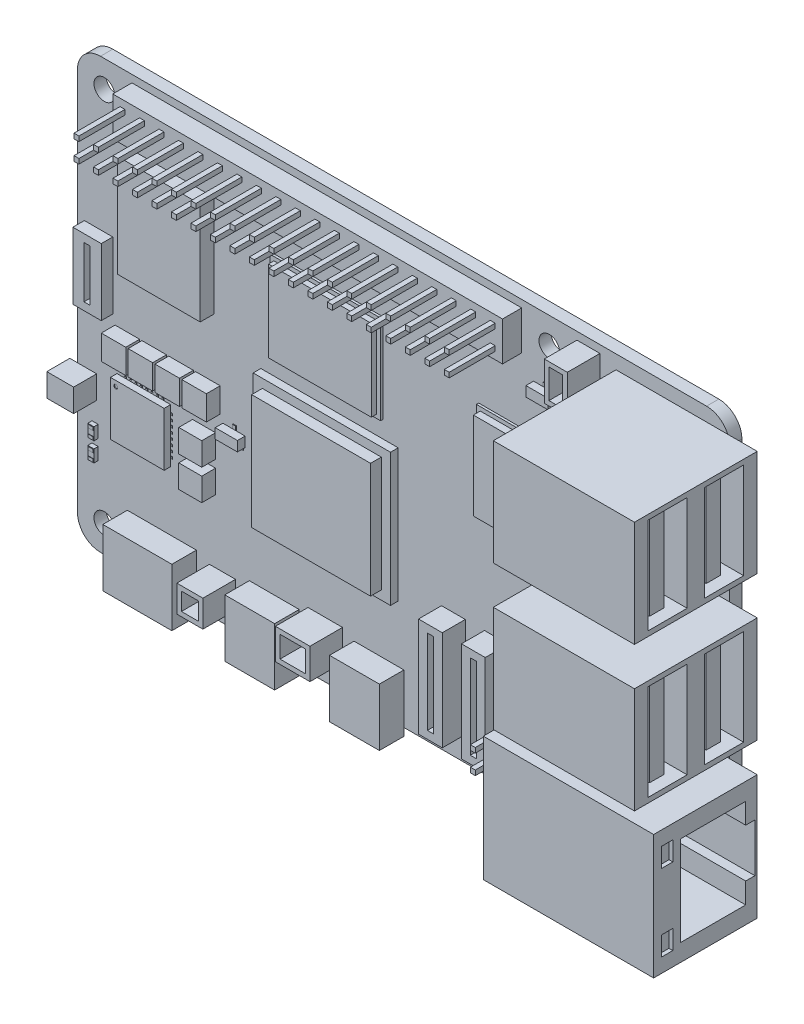
from build123d import *

# Parameters (mm, degrees)
PCB_DEPTH              = 1.6
SKETCH2_W              = 50.8
SKETCH2_H              = 5.08
SKETCH2_W_2            = 5.08
HEADER_BLOCKS_DEPTH    = 2.5
SKETCH3_W              = 0.64
SKETCH3_H              = 0.64
HEADER_PINS_DEPTH      = 6
SKETCH4_W              = 0.25
SKETCH4_H              = 0.3
SKETCH4_W_2            = 0.3
SKETCH4_H_2            = 0.25
PARTS_ADD00_DEPTH      = 0.05
SKETCH5_W              = 0.4
SKETCH5_H              = 0.7
PARTS_ADD01_DEPTH      = 0.1
SKETCH6_W              = 14.4
SKETCH6_H              = 11.6
SKETCH6_W_2            = 12.9
SKETCH6_H_2            = 12.4
PARTS_ADD02_DEPTH      = 0.3
SKETCH7_W              = 0.8
SKETCH7_H              = 1.6
PARTS_ADD03_DEPTH      = 0.55
PARTS_ADD04_DEPTH      = 0.9
SKETCH9_W              = 17.9
SKETCH9_H              = 17.3
PARTS_ADD05_DEPTH      = 1
SKETCH10_W             = 3.7
SKETCH10_H             = 8.7
PARTS_ADD06_DEPTH      = 1.5
SKETCH11_W             = 10.8
SKETCH11_H             = 13.3
SKETCH11_W_2           = 3.2
SKETCH11_H_2           = 3.2
SKETCH11_W_3           = 3
SKETCH11_H_3           = 3
PARTS_ADD07_DEPTH      = 1.8
SKETCH12_W             = 3.1
SKETCH12_H             = 13
SKETCH12_W_2           = 3.5
SKETCH12_H_2           = 3
PARTS_ADD08_DEPTH      = 3
SKETCH13_W             = 6.5
SKETCH13_H             = 7.5
SKETCH13_W_2           = 9
PARTS_ADD09_DEPTH      = 3.2
SKETCH14_W             = 3
SKETCH14_H             = 5
SKETCH14_W_2           = 4.5
SKETCH14_H_2           = 4
SKETCH14_W_3           = 3.4
SKETCH14_H_3           = 3.5
PARTS_ADD10_DEPTH      = 4.25
SKETCH15_W             = 22.2
SKETCH15_H             = 16.2
PARTS_ADD11_DEPTH      = 13.5
SKETCH16_W             = 18.4
SKETCH16_H             = 13.8
PARTS_ADD12_DEPTH      = 16
SKETCH17_W             = 7
SKETCH17_H             = 7
PARTS_ADD13_DEPTH      = 0.85
SKETCH18_W             = 4
SKETCH18_H             = 4.5
PARTS_ADD14_DEPTH      = 0.95
SKETCH19_W             = 2.9
SKETCH19_H             = 1.3
PARTS_ADD15_DEPTH      = 1
SKETCH20_W             = 13.4
SKETCH20_H             = 10.6
PARTS_ADD16_DEPTH      = 0.7
SKETCH21_W             = 11.9
SKETCH21_H             = 11.4
PARTS_ADD17_DEPTH      = 0.9
SKETCH22_W             = 0.7
SKETCH22_H             = 0.4
PARTS_ADD18_DEPTH      = 0.05
SKETCH23_W             = 15.5
SKETCH23_H             = 15
PARTS_ADD19_DEPTH      = 1.4
SKETCH24_W             = 1.5
SKETCH24_H             = 2.5
PARTS_CUT00_DEPTH      = 0.5
SKETCH25_W             = 1.9
SKETCH25_H             = 11
PARTS_CUT01_DEPTH      = 0.8
SKETCH26_W             = 5.1
SKETCH26_H             = 12.5
SKETCH26_W_2           = 1.9
SKETCH26_H_2           = 11
PARTS_CUT02_DEPTH      = 14
PARTS_CUT03_DEPTH      = 18
SKETCH28_W             = 4.2
SKETCH28_H             = 0.6
SKETCH28_W_2           = 6.6
SKETCH28_H_2           = 0.7
PARTS_CUT04_DEPTH      = 0.5
SKETCH29_W             = 5.5
SKETCH29_H             = 2
SKETCH29_W_2           = 4.2
SKETCH29_H_2           = 0.6
SKETCH29_W_3           = 6.6
SKETCH29_H_3           = 0.7
PARTS_CUT05_DEPTH      = 7
SKETCH30_R             = 0.25
PARTS_CUT06_DEPTH      = 0.1
SKETCH31_R             = 0.25
PARTS_CUT07_DEPTH      = 0.1
SKETCH32_W             = 0.8
SKETCH32_H             = 6.7
PARTS_CUT08_DEPTH      = 1
SKETCH33_W             = 0.8
SKETCH33_H             = 11
PARTS_CUT09_DEPTH      = 2.5
SKETCH34_W             = 1.8
SKETCH34_H             = 3.8
SKETCH34_W_2           = 3.3
SKETCH34_H_2           = 2.8
SKETCH34_W_3           = 2.2
SKETCH34_H_3           = 2.3
PARTS_CUT10_DEPTH      = 3.25
MOUNT_HOLES_DEPTH      = 107.281324794
MOUNT_HOLES_DEPTH_BACK = 107.281324794
SKETCH35_R             = 1.35


with BuildPart() as part:
    # Sketch1 → PCB (new body)
    with BuildSketch(Plane.XY):
        with BuildLine():
            Line((3, 0), (82, 0))
            ThreePointArc((82, 0), (84.121320344, 0.878679656), (85, 3))
            Line((85, 3), (85, 53))
            ThreePointArc((85, 53), (84.121320344, 55.121320344), (82, 56))
            Line((82, 56), (3, 56))
            ThreePointArc((3, 56), (0.878679656, 55.121320344), (0, 53))
            Line((0, 53), (0, 3))
            ThreePointArc((0, 3), (0.878679656, 0.878679656), (3, 0))
        make_face()
    extrude(amount=PCB_DEPTH)

    # Sketch2 → Header_Blocks (add)
    with BuildSketch(Plane.XY.offset(1.6)):
        with Locations((32.5, 52.5)):
            Rectangle(SKETCH2_W, SKETCH2_H)
        with Locations((61.3, 9.3)):
            Rectangle(SKETCH2_W_2, SKETCH2_H)
    extrude(amount=HEADER_BLOCKS_DEPTH)

    # Sketch3 → Header_Pins (add)
    with BuildSketch(Plane.XY.offset(4.1)):
        with Locations((8.37, 51.23)):
            Rectangle(SKETCH3_W, SKETCH3_H)
        with Locations((8.37, 53.77)):
            Rectangle(SKETCH3_W, SKETCH3_H)
        with Locations((10.91, 51.23)):
            Rectangle(SKETCH3_W, SKETCH3_H)
        with Locations((10.91, 53.77)):
            Rectangle(SKETCH3_W, SKETCH3_H)
        with Locations((13.45, 51.23)):
            Rectangle(SKETCH3_W, SKETCH3_H)
        with Locations((13.45, 53.77)):
            Rectangle(SKETCH3_W, SKETCH3_H)
        with Locations((15.99, 51.23)):
            Rectangle(SKETCH3_W, SKETCH3_H)
        with Locations((15.99, 53.77)):
            Rectangle(SKETCH3_W, SKETCH3_H)
        with Locations((18.53, 51.23)):
            Rectangle(SKETCH3_W, SKETCH3_H)
        with Locations((18.53, 53.77)):
            Rectangle(SKETCH3_W, SKETCH3_H)
        with Locations((21.07, 51.23)):
            Rectangle(SKETCH3_W, SKETCH3_H)
        with Locations((21.07, 53.77)):
            Rectangle(SKETCH3_W, SKETCH3_H)
        with Locations((23.61, 51.23)):
            Rectangle(SKETCH3_W, SKETCH3_H)
        with Locations((23.61, 53.77)):
            Rectangle(SKETCH3_W, SKETCH3_H)
        with Locations((26.15, 51.23)):
            Rectangle(SKETCH3_W, SKETCH3_H)
        with Locations((26.15, 53.77)):
            Rectangle(SKETCH3_W, SKETCH3_H)
        with Locations((28.69, 51.23)):
            Rectangle(SKETCH3_W, SKETCH3_H)
        with Locations((28.69, 53.77)):
            Rectangle(SKETCH3_W, SKETCH3_H)
        with Locations((31.23, 51.23)):
            Rectangle(SKETCH3_W, SKETCH3_H)
        with Locations((31.23, 53.77)):
            Rectangle(SKETCH3_W, SKETCH3_H)
        with Locations((33.77, 51.23)):
            Rectangle(SKETCH3_W, SKETCH3_H)
        with Locations((33.77, 53.77)):
            Rectangle(SKETCH3_W, SKETCH3_H)
        with Locations((36.31, 51.23)):
            Rectangle(SKETCH3_W, SKETCH3_H)
        with Locations((36.31, 53.77)):
            Rectangle(SKETCH3_W, SKETCH3_H)
        with Locations((38.85, 51.23)):
            Rectangle(SKETCH3_W, SKETCH3_H)
        with Locations((38.85, 53.77)):
            Rectangle(SKETCH3_W, SKETCH3_H)
        with Locations((41.39, 51.23)):
            Rectangle(SKETCH3_W, SKETCH3_H)
        with Locations((41.39, 53.77)):
            Rectangle(SKETCH3_W, SKETCH3_H)
        with Locations((43.93, 51.23)):
            Rectangle(SKETCH3_W, SKETCH3_H)
        with Locations((43.93, 53.77)):
            Rectangle(SKETCH3_W, SKETCH3_H)
        with Locations((46.47, 51.23)):
            Rectangle(SKETCH3_W, SKETCH3_H)
        with Locations((46.47, 53.77)):
            Rectangle(SKETCH3_W, SKETCH3_H)
        with Locations((49.01, 51.23)):
            Rectangle(SKETCH3_W, SKETCH3_H)
        with Locations((49.01, 53.77)):
            Rectangle(SKETCH3_W, SKETCH3_H)
        with Locations((51.55, 51.23)):
            Rectangle(SKETCH3_W, SKETCH3_H)
        with Locations((51.55, 53.77)):
            Rectangle(SKETCH3_W, SKETCH3_H)
        with Locations((54.09, 51.23)):
            Rectangle(SKETCH3_W, SKETCH3_H)
        with Locations((54.09, 53.77)):
            Rectangle(SKETCH3_W, SKETCH3_H)
        with Locations((56.63, 51.23)):
            Rectangle(SKETCH3_W, SKETCH3_H)
        with Locations((56.63, 53.77)):
            Rectangle(SKETCH3_W, SKETCH3_H)
        with Locations((60.03, 8.03)):
            Rectangle(SKETCH3_W, SKETCH3_H)
        with Locations((60.03, 10.57)):
            Rectangle(SKETCH3_W, SKETCH3_H)
        with Locations((62.57, 8.03)):
            Rectangle(SKETCH3_W, SKETCH3_H)
        with Locations((62.57, 10.57)):
            Rectangle(SKETCH3_W, SKETCH3_H)
    extrude(amount=HEADER_PINS_DEPTH)

    # Sketch4 → Parts_add00 (add)
    with BuildSketch(Plane.XY.offset(1.6)):
        with Locations((6.25, 14.25)):
            Rectangle(SKETCH4_W, SKETCH4_H)
        with Locations((5.15, 15.35)):
            Rectangle(SKETCH4_W_2, SKETCH4_H_2)
        with Locations((6.25, 21.35)):
            Rectangle(SKETCH4_W, SKETCH4_H)
        with Locations((12.25, 15.35)):
            Rectangle(SKETCH4_W_2, SKETCH4_H_2)
        with Locations((6.95, 14.25)):
            Rectangle(SKETCH4_W, SKETCH4_H)
        with Locations((5.15, 16.05)):
            Rectangle(SKETCH4_W_2, SKETCH4_H_2)
        with Locations((6.95, 21.35)):
            Rectangle(SKETCH4_W, SKETCH4_H)
        with Locations((12.25, 16.05)):
            Rectangle(SKETCH4_W_2, SKETCH4_H_2)
        with Locations((7.65, 14.25)):
            Rectangle(SKETCH4_W, SKETCH4_H)
        with Locations((5.15, 16.75)):
            Rectangle(SKETCH4_W_2, SKETCH4_H_2)
        with Locations((7.65, 21.35)):
            Rectangle(SKETCH4_W, SKETCH4_H)
        with Locations((12.25, 16.75)):
            Rectangle(SKETCH4_W_2, SKETCH4_H_2)
        with Locations((8.35, 14.25)):
            Rectangle(SKETCH4_W, SKETCH4_H)
        with Locations((5.15, 17.45)):
            Rectangle(SKETCH4_W_2, SKETCH4_H_2)
        with Locations((8.35, 21.35)):
            Rectangle(SKETCH4_W, SKETCH4_H)
        with Locations((12.25, 17.45)):
            Rectangle(SKETCH4_W_2, SKETCH4_H_2)
        with Locations((9.05, 14.25)):
            Rectangle(SKETCH4_W, SKETCH4_H)
        with Locations((5.15, 18.15)):
            Rectangle(SKETCH4_W_2, SKETCH4_H_2)
        with Locations((9.05, 21.35)):
            Rectangle(SKETCH4_W, SKETCH4_H)
        with Locations((12.25, 18.15)):
            Rectangle(SKETCH4_W_2, SKETCH4_H_2)
        with Locations((9.75, 14.25)):
            Rectangle(SKETCH4_W, SKETCH4_H)
        with Locations((5.15, 18.85)):
            Rectangle(SKETCH4_W_2, SKETCH4_H_2)
        with Locations((9.75, 21.35)):
            Rectangle(SKETCH4_W, SKETCH4_H)
        with Locations((12.25, 18.85)):
            Rectangle(SKETCH4_W_2, SKETCH4_H_2)
        with Locations((10.45, 14.225)):
            Rectangle(SKETCH4_W, SKETCH4_H_2)
        with Locations((5.125, 19.55)):
            Rectangle(SKETCH4_W, SKETCH4_H_2)
        with Locations((10.45, 21.35)):
            Rectangle(SKETCH4_W, SKETCH4_H)
        with Locations((12.25, 19.55)):
            Rectangle(SKETCH4_W_2, SKETCH4_H_2)
        with Locations((11.15, 14.25)):
            Rectangle(SKETCH4_W, SKETCH4_H)
        with Locations((5.15, 20.25)):
            Rectangle(SKETCH4_W_2, SKETCH4_H_2)
        with Locations((11.15, 21.35)):
            Rectangle(SKETCH4_W, SKETCH4_H)
        with Locations((12.25, 20.25)):
            Rectangle(SKETCH4_W_2, SKETCH4_H_2)
        with Locations((66.4, 43.3)):
            Rectangle(SKETCH4_W, SKETCH4_H)
        with Locations((65.35, 44.6)):
            Rectangle(SKETCH4_W_2, SKETCH4_H_2)
        with Locations((66.4, 47.9)):
            Rectangle(SKETCH4_W, SKETCH4_H)
        with Locations((69.45, 44.6)):
            Rectangle(SKETCH4_W_2, SKETCH4_H_2)
        with Locations((67.066666667, 43.3)):
            Rectangle(SKETCH4_W, SKETCH4_H)
        with Locations((65.35, 45.266666667)):
            Rectangle(SKETCH4_W_2, SKETCH4_H_2)
        with Locations((67.066666667, 47.9)):
            Rectangle(SKETCH4_W, SKETCH4_H)
        with Locations((69.45, 45.266666667)):
            Rectangle(SKETCH4_W_2, SKETCH4_H_2)
        with Locations((67.733333333, 43.3)):
            Rectangle(SKETCH4_W, SKETCH4_H)
        with Locations((65.35, 45.933333333)):
            Rectangle(SKETCH4_W_2, SKETCH4_H_2)
        with Locations((67.733333333, 47.9)):
            Rectangle(SKETCH4_W, SKETCH4_H)
        with Locations((69.45, 45.933333333)):
            Rectangle(SKETCH4_W_2, SKETCH4_H_2)
        with Locations((68.4, 43.3)):
            Rectangle(SKETCH4_W, SKETCH4_H)
        with Locations((65.35, 46.6)):
            Rectangle(SKETCH4_W_2, SKETCH4_H_2)
        with Locations((68.4, 47.9)):
            Rectangle(SKETCH4_W, SKETCH4_H)
        with Locations((69.45, 46.6)):
            Rectangle(SKETCH4_W_2, SKETCH4_H_2)
    extrude(amount=PARTS_ADD00_DEPTH)

    # Sketch5 → Parts_add01 (add)
    with BuildSketch(Plane.XY.offset(1.6)):
        with Locations((19.55, 21.2)):
            Rectangle(SKETCH5_W, SKETCH5_H)
        with Locations((21.45, 21.2)):
            Rectangle(SKETCH5_W, SKETCH5_H)
        with Locations((20.5, 22.8)):
            Rectangle(SKETCH5_W, SKETCH5_H)
        with Locations((58.55, 17.2)):
            Rectangle(SKETCH5_W, SKETCH5_H)
        with Locations((60.45, 17.2)):
            Rectangle(SKETCH5_W, SKETCH5_H)
        with Locations((59.5, 18.8)):
            Rectangle(SKETCH5_W, SKETCH5_H)
        with Locations((60.05, 46.2)):
            Rectangle(SKETCH5_W, SKETCH5_H)
        with Locations((61.95, 46.2)):
            Rectangle(SKETCH5_W, SKETCH5_H)
        with Locations((61, 47.8)):
            Rectangle(SKETCH5_W, SKETCH5_H)
    extrude(amount=PARTS_ADD01_DEPTH)

    # Sketch6 → Parts_add02 (add)
    with BuildSketch(Plane.XY.offset(1.6)):
        with Locations((32.6, 39.2)):
            Rectangle(SKETCH6_W, SKETCH6_H)
        with Locations((58.75, 35.3)):
            Rectangle(SKETCH6_W_2, SKETCH6_H_2)
    extrude(amount=PARTS_ADD02_DEPTH)

    # Sketch7 → Parts_add03 (add)
    with BuildSketch(Plane.XY.offset(1.6)):
        with Locations((2.3, 11)):
            Rectangle(SKETCH7_W, SKETCH7_H)
        with Locations((2.3, 13.5)):
            Rectangle(SKETCH7_W, SKETCH7_H)
    extrude(amount=PARTS_ADD03_DEPTH)

    # Sketch8 → Parts_add04 (add)
    with BuildSketch(Plane.XY.offset(1.6)):
        Polygon((62.7, 19.918019485), (65.881980515, 23.1), (62.7, 26.281980515), (59.518019485, 23.1), align=None)
    extrude(amount=PARTS_ADD04_DEPTH)

    # Sketch9 → Parts_add05 (add)
    with BuildSketch(Plane.XY.offset(1.6)):
        with Locations((32.85, 22.55)):
            Rectangle(SKETCH9_W, SKETCH9_H)
    extrude(amount=PARTS_ADD05_DEPTH)

    # Sketch10 → Parts_add06 (add)
    with BuildSketch(Plane.XY.offset(1.6)):
        with Locations((2.75, 32.05)):
            Rectangle(SKETCH10_W, SKETCH10_H)
    extrude(amount=PARTS_ADD06_DEPTH)

    # Sketch11 → Parts_add07 (add)
    with BuildSketch(Plane.XY.offset(1.6)):
        with Locations((12.4, 40.95)):
            Rectangle(SKETCH11_W, SKETCH11_H)
        with Locations((6.5, 25)):
            Rectangle(SKETCH11_W_2, SKETCH11_H_2)
        with Locations((10, 25)):
            Rectangle(SKETCH11_W_2, SKETCH11_H_2)
        with Locations((13.5, 25)):
            Rectangle(SKETCH11_W_2, SKETCH11_H_2)
        with Locations((17, 25)):
            Rectangle(SKETCH11_W_2, SKETCH11_H_2)
        with Locations((16.5, 19.5)):
            Rectangle(SKETCH11_W_3, SKETCH11_H_3)
        with Locations((16.5, 15.5)):
            Rectangle(SKETCH11_W_3, SKETCH11_H_3)
    extrude(amount=PARTS_ADD07_DEPTH)

    # Sketch12 → Parts_add08 (add)
    with BuildSketch(Plane.XY.offset(1.6)):
        with Locations((54.6, 9.7)):
            Rectangle(SKETCH12_W, SKETCH12_H)
        with Locations((49, 9.7)):
            Rectangle(SKETCH12_W, SKETCH12_H)
        with Locations((0.75, 18.4)):
            Rectangle(SKETCH12_W_2, SKETCH12_H_2)
    extrude(amount=PARTS_ADD08_DEPTH)

    # Sketch13 → Parts_add09 (add)
    with BuildSketch(Plane.XY.offset(1.6)):
        with Locations((25.65, 2.75)):
            Rectangle(SKETCH13_W, SKETCH13_H)
        with Locations((39.3, 2.75)):
            Rectangle(SKETCH13_W, SKETCH13_H)
        with Locations((11, 2.75)):
            Rectangle(SKETCH13_W_2, SKETCH13_H)
    extrude(amount=PARTS_ADD09_DEPTH)

    # Sketch14 → Parts_add10 (add)
    with BuildSketch(Plane.XY.offset(1.6)):
        with Locations((66.6, 52.5)):
            Rectangle(SKETCH14_W, SKETCH14_H)
        with Locations((32.3, 5.3)):
            Rectangle(SKETCH14_W_2, SKETCH14_H_2)
        with Locations((18.9, 4)):
            Rectangle(SKETCH14_W_3, SKETCH14_H_3)
    extrude(amount=PARTS_ADD10_DEPTH)

    # Sketch15 → Parts_add11 (add)
    with BuildSketch(Plane.XY.offset(1.6)):
        with Locations((77.5, 9.6)):
            Rectangle(SKETCH15_W, SKETCH15_H)
    extrude(amount=PARTS_ADD11_DEPTH)

    # Sketch16 → Parts_add12 (add)
    with BuildSketch(Plane.XY.offset(1.6)):
        with Locations((79.4, 47.3)):
            Rectangle(SKETCH16_W, SKETCH16_H)
        with Locations((79.4, 28.5)):
            Rectangle(SKETCH16_W, SKETCH16_H)
    extrude(amount=PARTS_ADD12_DEPTH)

    # Sketch17 → Parts_add13 (add)
    with BuildSketch(Plane.XY.offset(1.65)):
        with Locations((8.7, 17.8)):
            Rectangle(SKETCH17_W, SKETCH17_H)
    extrude(amount=PARTS_ADD13_DEPTH)

    # Sketch18 → Parts_add14 (add)
    with BuildSketch(Plane.XY.offset(1.65)):
        with Locations((67.4, 45.6)):
            Rectangle(SKETCH18_W, SKETCH18_H)
    extrude(amount=PARTS_ADD14_DEPTH)

    # Sketch19 → Parts_add15 (add)
    with BuildSketch(Plane.XY.offset(1.7)):
        with Locations((20.5, 22)):
            Rectangle(SKETCH19_W, SKETCH19_H)
        with Locations((59.5, 18)):
            Rectangle(SKETCH19_W, SKETCH19_H)
        with Locations((61, 47)):
            Rectangle(SKETCH19_W, SKETCH19_H)
    extrude(amount=PARTS_ADD15_DEPTH)

    # Sketch20 → Parts_add16 (add)
    with BuildSketch(Plane.XY.offset(1.9)):
        with Locations((32.6, 39.2)):
            Rectangle(SKETCH20_W, SKETCH20_H)
    extrude(amount=PARTS_ADD16_DEPTH)

    # Sketch21 → Parts_add17 (add)
    with BuildSketch(Plane.XY.offset(1.9)):
        with Locations((58.75, 35.3)):
            Rectangle(SKETCH21_W, SKETCH21_H)
    extrude(amount=PARTS_ADD17_DEPTH)

    # Sketch22 → Parts_add18 (add)
    with BuildSketch(Plane.XY.offset(2.15)):
        with Locations((2.3, 10.45)):
            Rectangle(SKETCH22_W, SKETCH22_H)
        with Locations((2.3, 11.55)):
            Rectangle(SKETCH22_W, SKETCH22_H)
        with Locations((2.3, 12.95)):
            Rectangle(SKETCH22_W, SKETCH22_H)
        with Locations((2.3, 14.05)):
            Rectangle(SKETCH22_W, SKETCH22_H)
    extrude(amount=PARTS_ADD18_DEPTH)

    # Sketch23 → Parts_add19 (add)
    with BuildSketch(Plane.XY.offset(2.6)):
        with Locations((32.85, 22.55)):
            Rectangle(SKETCH23_W, SKETCH23_H)
    extrude(amount=PARTS_ADD19_DEPTH)

    # Sketch24 → Parts_cut00 (cut)
    with BuildSketch(Plane(origin=(88.6, 0, 0), x_dir=(0, 0, -1), z_dir=(1, 0, 0))):
        with Locations((-13.35, 4.6)):
            Rectangle(SKETCH24_W, SKETCH24_H)
        with Locations((-13.35, 14.6)):
            Rectangle(SKETCH24_W, SKETCH24_H)
    extrude(amount=-PARTS_CUT00_DEPTH, mode=Mode.SUBTRACT)

    # Sketch25 → Parts_cut01 (cut)
    with BuildSketch(Plane(origin=(88.6, 0, 0), x_dir=(0, 0, -1), z_dir=(1, 0, 0))):
        with Locations((-6.52, 47.3)):
            Rectangle(SKETCH25_W, SKETCH25_H)
        with Locations((-13.88, 47.3)):
            Rectangle(SKETCH25_W, SKETCH25_H)
        with Locations((-6.52, 28.5)):
            Rectangle(SKETCH25_W, SKETCH25_H)
        with Locations((-13.88, 28.5)):
            Rectangle(SKETCH25_W, SKETCH25_H)
    extrude(amount=-PARTS_CUT01_DEPTH, mode=Mode.SUBTRACT)

    # Sketch26 → Parts_cut02 (cut)
    # profile 1 of 4: a face of its own
    with BuildSketch(Plane(origin=(88.6, 0, 0), x_dir=(0, 0, -1), z_dir=(1, 0, 0))):
        with Locations((-5.92, 47.3)):
            Rectangle(SKETCH26_W, SKETCH26_H)
        with Locations((-6.52, 47.3)):
            Rectangle(SKETCH26_W_2, SKETCH26_H_2, mode=Mode.SUBTRACT)
    # profile 2 of 4: a face of its own
    with BuildSketch(Plane(origin=(88.6, 0, 0), x_dir=(0, 0, -1), z_dir=(1, 0, 0))):
        with Locations((-13.28, 47.3)):
            Rectangle(SKETCH26_W, SKETCH26_H)
        with Locations((-13.88, 47.3)):
            Rectangle(SKETCH26_W_2, SKETCH26_H_2, mode=Mode.SUBTRACT)
    # profile 3 of 4: a face of its own
    with BuildSketch(Plane(origin=(88.6, 0, 0), x_dir=(0, 0, -1), z_dir=(1, 0, 0))):
        with Locations((-5.92, 28.5)):
            Rectangle(SKETCH26_W, SKETCH26_H)
        with Locations((-6.52, 28.5)):
            Rectangle(SKETCH26_W_2, SKETCH26_H_2, mode=Mode.SUBTRACT)
    # profile 4 of 4: a face of its own
    with BuildSketch(Plane(origin=(88.6, 0, 0), x_dir=(0, 0, -1), z_dir=(1, 0, 0))):
        with Locations((-13.28, 28.5)):
            Rectangle(SKETCH26_W, SKETCH26_H)
        with Locations((-13.88, 28.5)):
            Rectangle(SKETCH26_W_2, SKETCH26_H_2, mode=Mode.SUBTRACT)
    extrude(amount=-PARTS_CUT02_DEPTH, mode=Mode.SUBTRACT)

    # Sketch27 → Parts_cut03 (cut)
    with BuildSketch(Plane(origin=(88.6, 0, 0), x_dir=(0, 0, -1), z_dir=(1, 0, 0))):
        Polygon((-3.1, 3.75), (-3.1, 6.45), (-1.9, 6.45), (-1.9, 12.75), (-3.1, 12.75), (-3.1, 15.45), (-11.6, 15.45), (-11.6, 3.75), align=None)
    extrude(amount=-PARTS_CUT03_DEPTH, mode=Mode.SUBTRACT)

    # Sketch28 → Parts_cut04 (cut)
    with BuildSketch(Plane(origin=(0, -1, 0), x_dir=(1, 0, 0), z_dir=(0, 1, 0))):
        with Locations((25.65, -3.2)):
            Rectangle(SKETCH28_W, SKETCH28_H)
        with Locations((39.3, -3.2)):
            Rectangle(SKETCH28_W, SKETCH28_H)
        with Locations((11, -3.2)):
            Rectangle(SKETCH28_W_2, SKETCH28_H_2)
    extrude(amount=PARTS_CUT04_DEPTH, mode=Mode.SUBTRACT)

    # Sketch29 → Parts_cut05 (cut)
    # profile 1 of 3: a face of its own
    with BuildSketch(Plane(origin=(0, 6, 0), x_dir=(1, 0, 0), z_dir=(0, 1, 0))):
        with Locations((25.65, -3.2)):
            Rectangle(SKETCH29_W, SKETCH29_H)
        with Locations((25.65, -3.2)):
            Rectangle(SKETCH29_W_2, SKETCH29_H_2, mode=Mode.SUBTRACT)
    # profile 2 of 3: a face of its own
    with BuildSketch(Plane(origin=(0, 6, 0), x_dir=(1, 0, 0), z_dir=(0, 1, 0))):
        with BuildLine():
            Line((8.1, -2.25), (13.9, -2.25))
            ThreePointArc((13.9, -2.25), (15.15, -3.5), (13.9, -4.75))
            Line((13.9, -4.75), (8.1, -4.75))
            ThreePointArc((8.1, -4.75), (6.85, -3.5), (8.1, -2.25))
        make_face()
        with Locations((11, -3.2)):
            Rectangle(SKETCH29_W_3, SKETCH29_H_3, mode=Mode.SUBTRACT)
    # profile 3 of 3: a face of its own
    with BuildSketch(Plane(origin=(0, 6, 0), x_dir=(1, 0, 0), z_dir=(0, 1, 0))):
        with Locations((39.3, -3.2)):
            Rectangle(SKETCH29_W, SKETCH29_H)
        with Locations((39.3, -3.2)):
            Rectangle(SKETCH29_W_2, SKETCH29_H_2, mode=Mode.SUBTRACT)
    extrude(amount=-PARTS_CUT05_DEPTH, mode=Mode.SUBTRACT)

    # Sketch30 → Parts_cut06 (cut)
    with BuildSketch(Plane.XY.offset(2.5)):
        with Locations((5.9, 20.6)):
            Circle(SKETCH30_R)
    extrude(amount=-PARTS_CUT06_DEPTH, mode=Mode.SUBTRACT)

    # Sketch31 → Parts_cut07 (cut)
    with BuildSketch(Plane.XY.offset(2.6)):
        with Locations((66.1, 47.15)):
            Circle(SKETCH31_R)
    extrude(amount=-PARTS_CUT07_DEPTH, mode=Mode.SUBTRACT)

    # Sketch32 → Parts_cut08 (cut)
    with BuildSketch(Plane.XY.offset(3.1)):
        with Locations((2.75, 32.05)):
            Rectangle(SKETCH32_W, SKETCH32_H)
    extrude(amount=-PARTS_CUT08_DEPTH, mode=Mode.SUBTRACT)

    # Sketch33 → Parts_cut09 (cut)
    with BuildSketch(Plane.XY.offset(4.6)):
        with Locations((54.6, 9.7)):
            Rectangle(SKETCH33_W, SKETCH33_H)
        with Locations((49, 9.7)):
            Rectangle(SKETCH33_W, SKETCH33_H)
    extrude(amount=-PARTS_CUT09_DEPTH, mode=Mode.SUBTRACT)

    # Sketch34 → Parts_cut10 (cut)
    with BuildSketch(Plane.XY.offset(5.85)):
        with Locations((66.6, 52.5)):
            Rectangle(SKETCH34_W, SKETCH34_H)
        with Locations((32.3, 5.3)):
            Rectangle(SKETCH34_W_2, SKETCH34_H_2)
        with Locations((18.9, 4)):
            Rectangle(SKETCH34_W_3, SKETCH34_H_3)
    extrude(amount=-PARTS_CUT10_DEPTH, mode=Mode.SUBTRACT)

    # Sketch35 → Mount_Holes (cut, two sides: drawn at the far end of the back side and taken through both)
    with BuildSketch(Plane.XY.offset(-MOUNT_HOLES_DEPTH_BACK)):
        with Locations((3.5, 3.5)):
            Circle(SKETCH35_R)
        with Locations((3.5, 52.5)):
            Circle(SKETCH35_R)
        with Locations((61.5, 3.5)):
            Circle(SKETCH35_R)
        with Locations((61.5, 52.5)):
            Circle(SKETCH35_R)
    extrude(amount=MOUNT_HOLES_DEPTH + MOUNT_HOLES_DEPTH_BACK, mode=Mode.SUBTRACT)


solid = part.part
